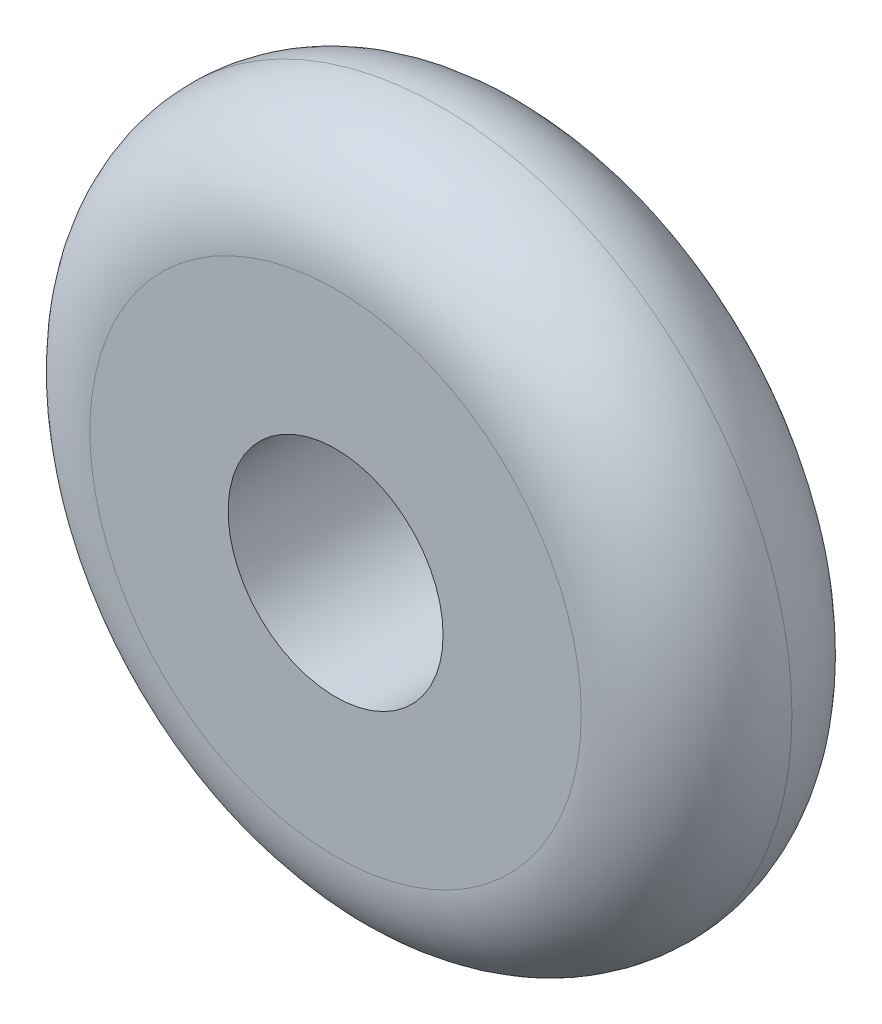
from build123d import *

# Parameters (mm, degrees)
ESQUISSE1_R        = 40
ESQUISSE1_R_2      = 12.25
BOSS_EXTRU_1_DEPTH = 24
CONG_1_R           = 12


with BuildPart() as part:
    # Esquisse1 → Boss.-Extru.1 (new body)
    with BuildSketch(Plane.XY):
        Circle(ESQUISSE1_R)
        Circle(ESQUISSE1_R_2, mode=Mode.SUBTRACT)
    extrude(amount=BOSS_EXTRU_1_DEPTH)

    # Congé1
    cong_1_edges = [part.edges().sort_by_distance(p)[0] for p in [
        (-40, 0, 0),
        (-40, 0, 24),
    ]]
    fillet(cong_1_edges, radius=CONG_1_R - 0.0001)  # a hair under: the kernel refuses the full size


solid = part.part
